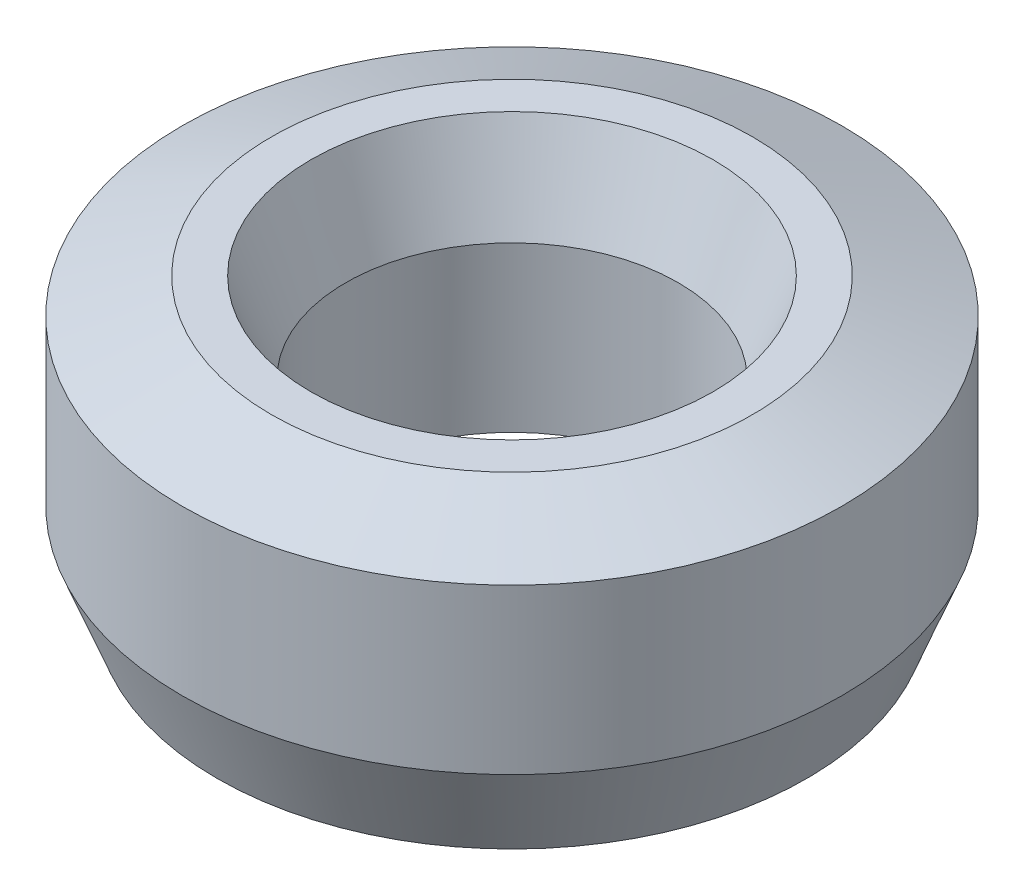
from build123d import *
from OCP.BRepFilletAPI import BRepFilletAPI_MakeChamfer

# Parameters (mm, degrees)
SKETCH1_R           = 35
BOSS_EXTRUDE1_DEPTH = 30.575155298
SKETCH2_R           = 17.645730878
CUT_EXTRUDE1_DEPTH  = 59.179378834
CHAMFER1_SIZE       = 3.701165557
CHAMFER1_SIZE2      = 9.454966615


with BuildPart() as part:
    # Sketch1 → Boss-Extrude1 (new body)
    with BuildSketch(Plane(origin=(0, 0, 0), x_dir=(1, 0, 0), z_dir=(0, 1, 0))):
        Circle(SKETCH1_R)
    extrude(amount=BOSS_EXTRUDE1_DEPTH)

    # Sketch2 → Cut-Extrude1 (cut, through all)
    with BuildSketch(Plane(origin=(0, 0, 0), x_dir=(1, 0, 0), z_dir=(0, 1, 0))):
        Circle(SKETCH2_R)
    extrude(amount=CUT_EXTRUDE1_DEPTH, mode=Mode.SUBTRACT)

    # Chamfer1: one chamfer whose edges measure the first distance from different faces: ONE call of the kernel's chamfer builder (chamfer() names one face for all edges)
    chamfer1_edges_1 = [part.edges().sort_by_distance(p)[0] for p in [
        (-17.645730878, 30.575155298, 0),
    ]]
    chamfer1_side_1 = [part.faces().sort_by_distance(p)[0] for p in [
        (-34.010050506, 30.575155298, 0),
    ]]
    chamfer1_edges_2 = [part.edges().sort_by_distance(p)[0] for p in [
        (-17.645730878, 0, 0),
    ]]
    chamfer1_side_2 = [part.faces().sort_by_distance(p)[0] for p in [
        (-17.645730878, 15.287577649, 0),
    ]]
    chamfer1_edges_3 = [part.edges().sort_by_distance(p)[0] for p in [
        (-35, 0, 0),
    ]]
    chamfer1_side_3 = [part.faces().sort_by_distance(p)[0] for p in [
        (-34.010050506, 0, 0),
    ]]
    chamfer1_edges_4 = [part.edges().sort_by_distance(p)[0] for p in [
        (-35, 30.575155298, 0),
    ]]
    chamfer1_side_4 = [part.faces().sort_by_distance(p)[0] for p in [
        (-35, 15.287577649, 0),
    ]]
    chamfer1 = BRepFilletAPI_MakeChamfer(part.part.solid().wrapped)
    for e in chamfer1_edges_1:
        chamfer1.Add(CHAMFER1_SIZE, CHAMFER1_SIZE2, e.wrapped, chamfer1_side_1[0].wrapped)  # the first distance lies on this face
    for e in chamfer1_edges_2:
        chamfer1.Add(CHAMFER1_SIZE, CHAMFER1_SIZE2, e.wrapped, chamfer1_side_2[0].wrapped)  # the first distance lies on this face
    for e in chamfer1_edges_3:
        chamfer1.Add(CHAMFER1_SIZE, CHAMFER1_SIZE2, e.wrapped, chamfer1_side_3[0].wrapped)  # the first distance lies on this face
    for e in chamfer1_edges_4:
        chamfer1.Add(CHAMFER1_SIZE, CHAMFER1_SIZE2, e.wrapped, chamfer1_side_4[0].wrapped)  # the first distance lies on this face
    add(Compound.cast(chamfer1.Shape()), mode=Mode.REPLACE)


solid = part.part
